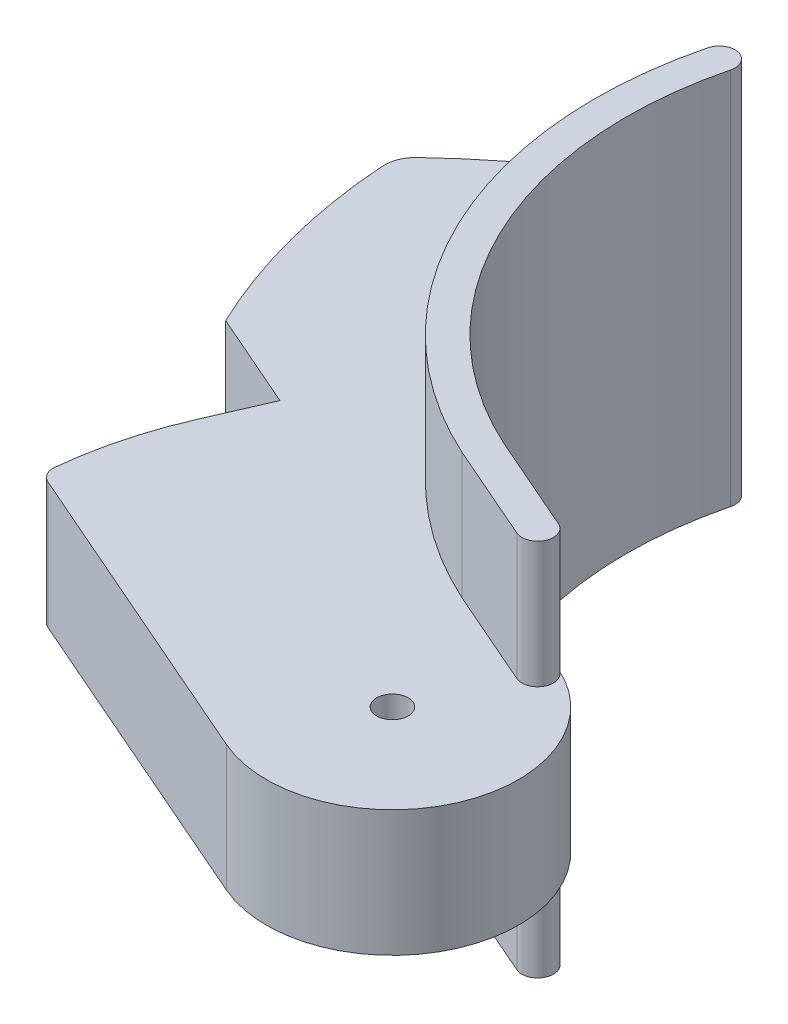
from build123d import *
from build123d.topology import SkipClean

# Parameters (mm, degrees)
BOSS_EXTRU_1_DEPTH      = 25.4
BOSS_EXTRU_3_DEPTH      = 25.4
BOSS_EXTRU_3_DEPTH_BACK = 50.8
ESQUISSE4_R             = 3.175
ENL_V_MAT_EXTRU_2_DEPTH = 181.045576616


with BuildPart() as part:
    # Esquisse1 → Boss.-Extru.1 (new body)
    with BuildSketch(Plane(origin=(0, 0, 0), x_dir=(1, 0, 0), z_dir=(0, 1, 0))):
        with BuildLine():
            Line((-86.988995356, -59.030471555), (-106.422794534, -50.551910349))
            ThreePointArc((-106.422794534, -50.551910349), (-109.945906268, -42.346245775), (-112.837401426, -33.897310746))
            ThreePointArc((-112.837401426, -33.897310746), (-115.930942089, -21.007701033), (-117.557008422, -7.852172131))
            ThreePointArc((-117.557008422, -7.852172131), (-117.13621005, -5.119362004), (-115.593885954, -2.824463565))
            ThreePointArc((-115.593885954, -2.824463565), (-97.983870719, 11.30660622), (-78.273017823, 22.319419119))
            ThreePointArc((-78.273017823, 22.319419119), (-74.924997914, 21.864997198), (-73.882142487, 18.651247184))
            ThreePointArc((-73.882142487, 18.651247184), (-68.674121781, -33.019766772), (-31.56784929, -69.353521116))
            Line((-31.56784929, -69.353521116), (-12.068063318, -77.860870983))
            ThreePointArc((-12.068063318, -77.860870983), (1.055821232, -111.298628897), (-32.381936682, -124.422513448))
            Line((-32.381936682, -124.422513448), (-96.139091412, -96.606596769))
            ThreePointArc((-96.139091412, -96.606596769), (-97.611067531, -95.297834712), (-98.027929733, -93.37278985))
            ThreePointArc((-98.027929733, -93.37278985), (-95.927030568, -81.790963802), (-92.067463697, -70.670882171))
            Line((-92.067463697, -70.670882171), (-86.988995356, -59.030471555))
        make_face()
    extrude(amount=BOSS_EXTRU_1_DEPTH)

    # Esquisse2 → Boss.-Extru.3 (add, two sides: drawn at the far end of the back side and taken through both)
    with SkipClean():  # the faces are left unmerged after this step: merging them gives an invalid solid
        with BuildSketch(Plane(origin=(0, 25.4, 0), x_dir=(1, 0, 0), z_dir=(0, 1, 0)).offset(-BOSS_EXTRU_3_DEPTH_BACK)):
            with BuildLine():
                Line((-12.068063318, -77.860870983), (-31.56784929, -69.353521116))
                ThreePointArc((-31.56784929, -69.353521116), (-68.674121781, -33.019766772), (-73.882142487, 18.651247184))
                ThreePointArc((-73.882142487, 18.651247184), (-76.183429791, 22.506805087), (-80.038987694, 20.205517783))
                ThreePointArc((-80.038987694, 20.205517783), (-74.38590155, -35.794415076), (-34.152036158, -75.1541145))
                Line((-34.152036158, -75.1541145), (-14.607297489, -83.681076291))
                ThreePointArc((-14.607297489, -83.681076291), (-10.42757775, -82.040590723), (-12.068063318, -77.860870983))
            make_face()
        extrude(amount=BOSS_EXTRU_3_DEPTH + BOSS_EXTRU_3_DEPTH_BACK)
    add(part.part.scale(1), mode=Mode.REPLACE)  # the faces are merged on a copy

    # Esquisse4 → Enlèv. mat.-Extru.2 (cut, through all)
    with BuildSketch(Plane(origin=(0, 25.4, 0), x_dir=(1, 0, 0), z_dir=(0, 1, 0))):
        with Locations((-22.225, -101.141692216)):
            Circle(ESQUISSE4_R)
    extrude(amount=-ENL_V_MAT_EXTRU_2_DEPTH, mode=Mode.SUBTRACT)


solid = part.part
